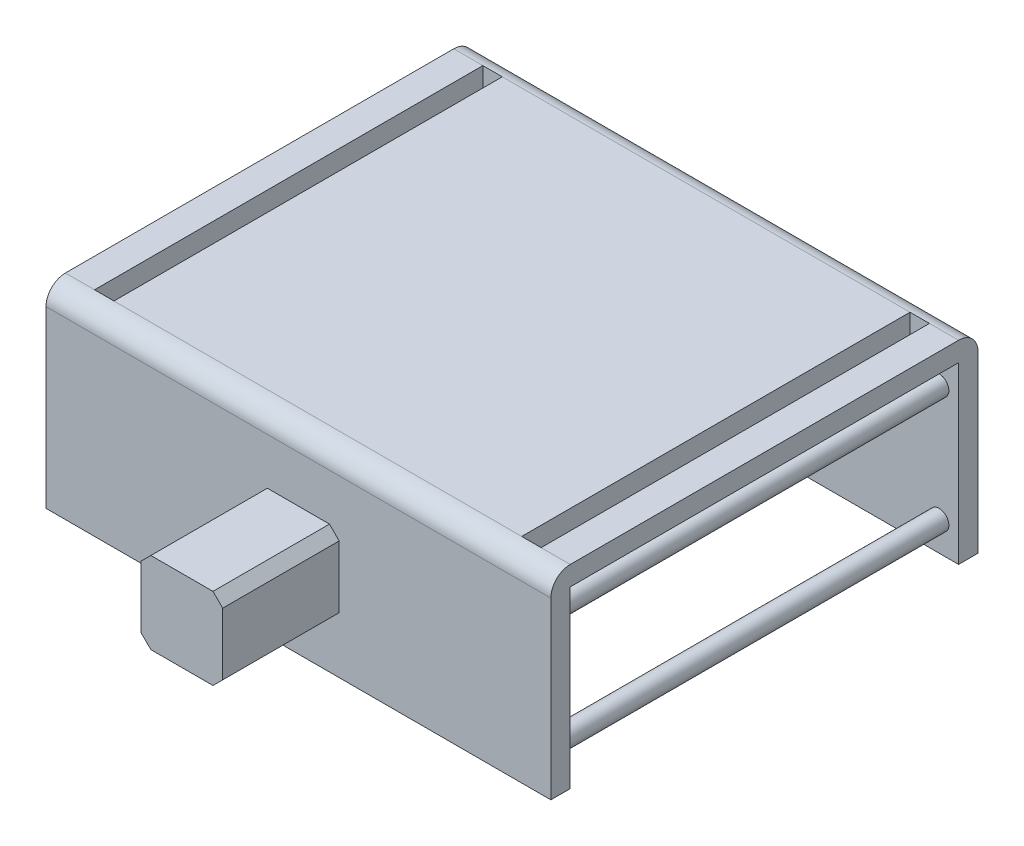
from build123d import *

# Parameters (mm, degrees)
SKETCH1_W                      = 130
SKETCH1_H                      = 45
SKETCH1_R                      = 5
BOSS_EXTRUDE1_DEPTH            = 10
SKETCH1_5_R                    = 5
BOSS_EXTRUDE2_DEPTH            = 100
MIRROR1_START                  = -10
MIRROR1_DEPTH                  = 10
MIRROR1_2_OUTLINE_R            = 5
MIRROR1_2_DEPTH                = 100
SKETCH2_W                      = 130
SKETCH2_H                      = 220
SKETCH2_W_2                    = 10
SKETCH2_H_2                    = 200
BOSS_EXTRUDE3_DEPTH            = 10
FILLET1_START                  = -131
FILLET1_DEPTH                  = 262
SKETCH3_W                      = 42
SKETCH3_H                      = 42
BOSS_EXTRUDE4_DEPTH            = 60
CHAMFER1_SIZE                  = 5
SKETCH4_R                      = 5
CUT_EXTRUDE1_DEPTH             = 10
CUT_EXTRUDE1_DIRECTION_2_REACH = 255.032


with BuildPart() as part:
    # Sketch1 → Boss-Extrude1 (new body)
    # profile 1 of 2: a face of its own
    with BuildSketch(Plane(origin=(0, 0, 0), x_dir=(1, 0, 0), z_dir=(0, 0, -1))):
        with Locations((-65, 22.5)):
            Rectangle(SKETCH1_W, SKETCH1_H)
        with Locations((-120, 30)):
            Circle(SKETCH1_R, mode=Mode.SUBTRACT)
    # profile 2 of 2: a face of its own
    with BuildSketch(Plane(origin=(0, 0, 0), x_dir=(1, 0, 0), z_dir=(0, 0, -1))):
        with Locations((-120, 30)):
            Circle(SKETCH1_R)
    extrude(amount=BOSS_EXTRUDE1_DEPTH)

    # Sketch1<5> → Boss-Extrude2 (add)
    with BuildSketch(Plane(origin=(0, 0, 0), x_dir=(1, 0, 0), z_dir=(0, 0, -1))):
        with Locations(Location((-120, 30, 0), (0, 0, 180))):
            Circle(SKETCH1_5_R)
    extrude(amount=-BOSS_EXTRUDE2_DEPTH)

    # Mirror1: read off the stored shape, not the designer's step
    # Mirror1 outline → Mirror1 (add)
    with BuildSketch(Plane.XY.offset(MIRROR1_START)):
        Polygon((130, 45), (-130, 45), (-130, 0), (0, 0), (0, -45), (130, -45), align=None)
    extrude(amount=MIRROR1_DEPTH)

    # Mirror1 2 outline → Mirror1 2 (add)
    with BuildSketch(Plane.XY):
        with Locations((120, -30)):
            Circle(MIRROR1_2_OUTLINE_R)
        with Locations((-120, 30)):
            Circle(MIRROR1_2_OUTLINE_R)
        with Locations((120, 30)):
            Circle(MIRROR1_2_OUTLINE_R)
    extrude(amount=MIRROR1_2_DEPTH)

    # Mirror2: part across plane


with BuildPart() as part_1:
    add(part.part)
    add(part.part.mirror(Plane(origin=(120, -30, 100), x_dir=(1, 0, 0), z_dir=(0, 0, -1))))

    # Sketch2 → Boss-Extrude3 (add)
    with BuildSketch(Plane(origin=(0, 45, 0), x_dir=(1, 0, 0), z_dir=(0, 1, 0))):
        with Locations((-65, -100)):
            Rectangle(SKETCH2_W, SKETCH2_H)
        with Locations((-110, -100)):
            Rectangle(SKETCH2_W_2, SKETCH2_H_2, mode=Mode.SUBTRACT)
    boss_extrude3 = extrude(amount=BOSS_EXTRUDE3_DEPTH)

    # Mirror3: Boss-Extrude3 across plane
    add(boss_extrude3.mirror(Plane(origin=(0, 55, -10), x_dir=(0, 0, 1), z_dir=(-1, 0, 0))))

    # Fillet1: read off the stored shape, not the designer's step
    # Fillet1 outline → Fillet1 (cut)
    with BuildSketch(Plane.YZ.offset(FILLET1_START)):
        with BuildLine():
            ThreePointArc((45, 210), (52.071067812, 207.071067812), (55, 200))
            Line((55, 200), (55, 210))
            Line((55, 210), (45, 210))
        make_face()
        with BuildLine():
            ThreePointArc((55, 0), (52.071067812, -7.071067812), (45, -10))
            Line((45, -10), (55, -10))
            Line((55, -10), (55, 0))
        make_face()
    extrude(amount=FILLET1_DEPTH, mode=Mode.SUBTRACT)

    # Sketch3 → Boss-Extrude4 (add)
    with BuildSketch(Plane.XY.offset(210)):
        Rectangle(SKETCH3_W, SKETCH3_H)
    extrude(amount=BOSS_EXTRUDE4_DEPTH)

    # Chamfer1
    chamfer1_edges = [part_1.edges().sort_by_distance(p)[0] for p in [
        (-21, -21, 240),
        (21, -21, 240),
        (21, 21, 240),
        (-21, 21, 240),
    ]]
    chamfer(chamfer1_edges, length=CHAMFER1_SIZE)

    # Sketch4 → Cut-Extrude1 (cut)
    with BuildSketch(Plane(origin=(0, 0, 200), x_dir=(-1, 0, 0), z_dir=(0, 0, -1))):
        with Locations(Location((0, 0, 0), (0, 0, 180))):
            Circle(SKETCH4_R)
    extrude(amount=-CUT_EXTRUDE1_DEPTH, mode=Mode.SUBTRACT)

    # Cut-Extrude1 direction 2: up to this face of the body (flat: up to its plane)
    cut_extrude1_direction_2_end = Plane(part_1.part.faces().sort_by_distance((0, 0, -10))[0])
    # Sketch4 → Cut-Extrude1 direction 2 (cut, up to the picked face)
    with BuildSketch(Plane(origin=(0, 0, 200), x_dir=(-1, 0, 0), z_dir=(0, 0, -1)), mode=Mode.PRIVATE) as cut_extrude1_direction_2_sk1:
        with Locations(Location((0, 0, 0), (0, 0, 180))):
            Circle(SKETCH4_R)
    cut_extrude1_direction_2_tool1 = split(extrude(cut_extrude1_direction_2_sk1.sketch, amount=CUT_EXTRUDE1_DIRECTION_2_REACH, mode=Mode.PRIVATE), bisect_by=cut_extrude1_direction_2_end, keep=Keep.BOTH, mode=Mode.PRIVATE)
    add(cut_extrude1_direction_2_tool1.solids().sort_by(Axis((0, 0, 200), (0, 0, -1)))[0], mode=Mode.SUBTRACT)


solid = part_1.part
